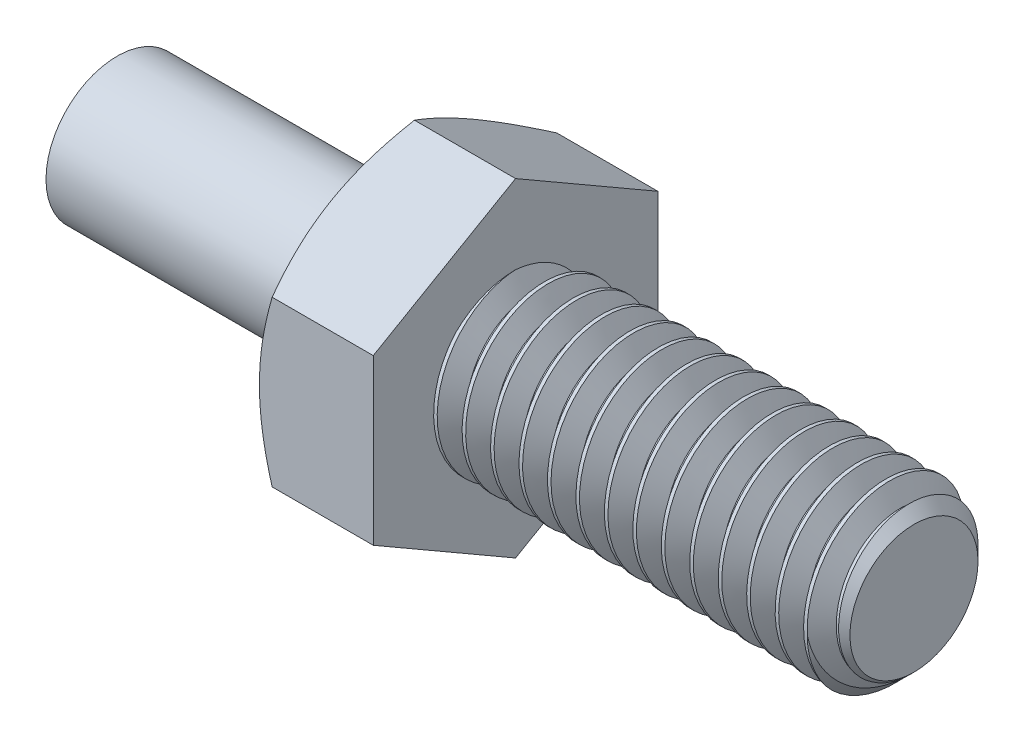
from build123d import *

# Parameters (mm, degrees)
SKETCH2_R           = 3
BOSS_EXTRUDE1_DEPTH = 14
CHAMFER1_SIZE       = 0.75
CUT_SWEEP1_PITCH    = 1
BOSS_EXTRUDE2_DEPTH = 4
SKETCH6_OUTSIDE_W   = 87.92
SKETCH6_OUTSIDE_H   = 89.468
SKETCH6_OUTSIDE_R   = 5
CUT_EXTRUDE1_DEPTH  = 20.553345982
CUT_EXTRUDE1_DRAFT  = -60
SKETCH10_R          = 2.5
BOSS_EXTRUDE3_DEPTH = 10


with BuildPart() as part:
    # Sketch2 → Boss-Extrude1 (new body)
    with BuildSketch(Plane(origin=(9, 0, 0), x_dir=(0, 0, -1), z_dir=(1, 0, 0))):
        Circle(SKETCH2_R)
    extrude(amount=-BOSS_EXTRUDE1_DEPTH)

    # Chamfer1
    chamfer1_edges = [part.edges().sort_by_distance(p)[0] for p in [
        (9, 0, 3),
    ]]
    chamfer(chamfer1_edges, length=CHAMFER1_SIZE)

    # Cut-Sweep1: the profile of Sketch5 profile screwed along a right-hand helix of 15 turns, 8 arcs to a turn; built about Z, then put on its axis
    cut_sweep1_z = Axis((0, 0, 0), (0, 0, 1))
    cut_sweep1_corners = [(3.0003, 0, 0.000173205), (2.350480947, 0, -0.375), (2.350480947, 0, -0.5), (3.0003, 0, -0.875173205)]
    with BuildLine(mode=Mode.PRIVATE) as cut_sweep1_profile:
        Line(cut_sweep1_corners[0], cut_sweep1_corners[1])
        Line(cut_sweep1_corners[1], cut_sweep1_corners[2])
        Line(cut_sweep1_corners[2], cut_sweep1_corners[3])
        Line(cut_sweep1_corners[3], cut_sweep1_corners[0])
    cut_sweep1_cap = Face(cut_sweep1_profile.wire())
    cut_sweep1_turn_angles = [0, 22.5, 45, 67.5, 90, 112.5, 135, 157.5, 180, 202.5, 225, 247.5, 270, 292.5, 315, 337.5, 360]
    cut_sweep1_turn_weights = [1, 0.9238795325112867, 1, 0.9238795325112867, 1, 0.9238795325112867, 1, 0.9238795325112867, 1, 0.9238795325112867, 1, 0.9238795325112867, 1, 0.9238795325112867, 1, 0.9238795325112867, 1]
    cut_sweep1_turn_rails = [Edge.make_bspline([Vector(p[0], p[1], 0).rotate(cut_sweep1_z, cut_sweep1_turn_angles[k]) / cut_sweep1_turn_weights[k] + Vector(0, 0, p[2] + CUT_SWEEP1_PITCH * cut_sweep1_turn_angles[k] / 360) for k in range(17)], [0, 0, 0, 1, 1, 2, 2, 3, 3, 4, 4, 5, 5, 6, 6, 7, 7, 8, 8, 8], 2, cut_sweep1_turn_weights) for p in cut_sweep1_corners]
    cut_sweep1_turn_sides = [Face.make_surface_from_curves(cut_sweep1_turn_rails[p[0]], cut_sweep1_turn_rails[p[1]]) for p in [(0, 1), (1, 2), (2, 3), (3, 0)]]
    cut_sweep1 = Plane(origin=(9, 0, 0), x_dir=(0, 1, 0), z_dir=(-1, 0, 0)) * Solid(Shell([*[p.moved(Location((0, 0, CUT_SWEEP1_PITCH * i))) for i in range(15) for p in cut_sweep1_turn_sides], cut_sweep1_cap, cut_sweep1_cap.rotate(cut_sweep1_z, 5400).moved(Location((0, 0, CUT_SWEEP1_PITCH * 5400 / 360)))]))
    add(cut_sweep1, mode=Mode.SUBTRACT)

    # Sketch3 → Boss-Extrude2 (add)
    with BuildSketch(Plane.ZY.offset(5)):
        Polygon((-5, -2.886751346), (0, -5.773502692), (5, -2.886751346), (5, 2.886751346), (0, 5.773502692), (-5, 2.886751346), align=None)
    extrude(amount=BOSS_EXTRUDE2_DEPTH)


with BuildPart() as cut_extrude1_tool:
    # Sketch6 outside → Cut-Extrude1 (with draft: the straight prism first)
    with BuildSketch(Plane.ZY.offset(9)):
        Rectangle(SKETCH6_OUTSIDE_W, SKETCH6_OUTSIDE_H)
        Circle(SKETCH6_OUTSIDE_R, mode=Mode.SUBTRACT)
    extrude(amount=-CUT_EXTRUDE1_DEPTH)
    # Cut-Extrude1: the draft: its side faces are tilted about the plane it starts from
    cut_extrude1_sides = [cut_extrude1_tool.faces().sort_by_distance(p)[0] for p in [
        (1.276672991, -44.734, 0),
        (1.276672991, 0, 43.96),
        (1.276672991, 44.734, 0),
        (1.276672991, 0, -43.96),
        (1.276672991, 0, -5),
    ]]
    draft(cut_extrude1_sides, Plane.ZY.offset(9), CUT_EXTRUDE1_DRAFT)


with BuildPart() as part_1:
    add(part.part)

    # Cut-Extrude1: cut by cut_extrude1_tool
    add(cut_extrude1_tool.part, mode=Mode.SUBTRACT)

    # Sketch10 → Boss-Extrude3 (add)
    with BuildSketch(Plane.ZY.offset(9)):
        Circle(SKETCH10_R)
    extrude(amount=BOSS_EXTRUDE3_DEPTH)


solid = part_1.part
